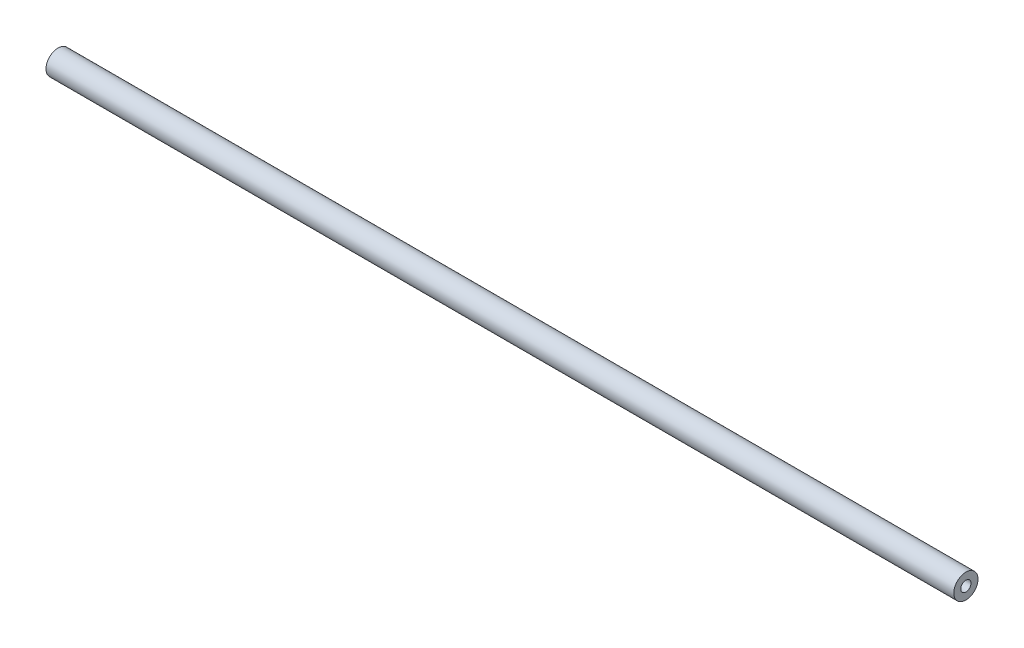
from build123d import *

# Parameters (mm, degrees)
SKETCH1_R                            = 4.7625
BOSS_EXTRUDE1_DEPTH                  = 178.59375
F_10_32_TAPPED_HOLE1_D               = 4.0386
F_10_32_TAPPED_HOLE1_DEPTH           = 12.02944
F_10_32_TAPPED_HOLE1_TIP             = 1.213317848
F_10_32_TAPPED_HOLE1_ON_FACE_2_D     = 4.0386
F_10_32_TAPPED_HOLE1_ON_FACE_2_DEPTH = 12.02944
F_10_32_TAPPED_HOLE1_ON_FACE_2_TIP   = 1.213317848


with BuildPart() as part:
    # Sketch1 → Boss-Extrude1 (new, symmetric)
    with BuildSketch(Plane(origin=(0, 0, 0), x_dir=(0, 0, -1), z_dir=(1, 0, 0))):
        Circle(SKETCH1_R)
    extrude(amount=BOSS_EXTRUDE1_DEPTH, both=True)

    # #10-32 Tapped Hole1
    with Locations(Plane(origin=(178.59375, 0, 0), x_dir=(0, 0, 1), z_dir=(1, 0, 0))):
        with Locations((0, 0)):
            Hole(F_10_32_TAPPED_HOLE1_D / 2, depth=F_10_32_TAPPED_HOLE1_DEPTH)
            with Locations((0, 0, -(F_10_32_TAPPED_HOLE1_DEPTH + F_10_32_TAPPED_HOLE1_TIP / 2))):  # 118° drill point
                Cone(0, F_10_32_TAPPED_HOLE1_D / 2, F_10_32_TAPPED_HOLE1_TIP, mode=Mode.SUBTRACT)

    # #10-32 Tapped Hole1 on face 2
    with Locations(Plane(origin=(-178.59375, 0, 0), x_dir=(0, 0, -1), z_dir=(-1, 0, 0))):
        with Locations((0, 0)):
            Hole(F_10_32_TAPPED_HOLE1_ON_FACE_2_D / 2, depth=F_10_32_TAPPED_HOLE1_ON_FACE_2_DEPTH)
            with Locations((0, 0, -(F_10_32_TAPPED_HOLE1_ON_FACE_2_DEPTH + F_10_32_TAPPED_HOLE1_ON_FACE_2_TIP / 2))):  # 118° drill point
                Cone(0, F_10_32_TAPPED_HOLE1_ON_FACE_2_D / 2, F_10_32_TAPPED_HOLE1_ON_FACE_2_TIP, mode=Mode.SUBTRACT)


solid = part.part
